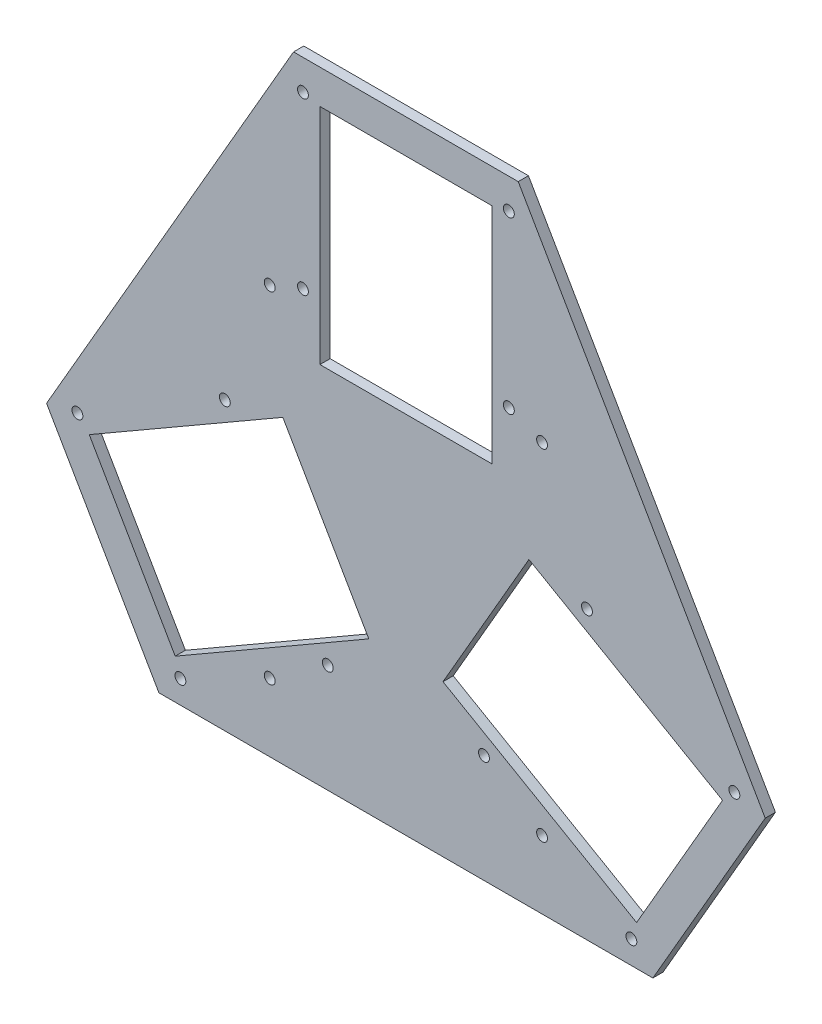
from build123d import *

# Parameters (mm, degrees)
SKETCH_1_R      = 1.6
SKETCH_1_W      = 50.5
SKETCH_1_H      = 65.673229248
EXTRUDE_1_DEPTH = 3


with BuildPart() as part:
    # ｽｹｯﾁ1 → ﾎﾞｽ - 押し出し1 (new body)
    with BuildSketch(Plane.XY):
        Polygon((33.003295935, 102.836614624), (-33.003295935, 102.836614624), (-105.560768671, -22.836614624), (-72.557472736, -80), (72.557472736, -80), (105.560768671, -22.836614624), align=None)
        with Locations((-66.245679964, -73.176652446)):
            Circle(SKETCH_1_R, mode=Mode.SUBTRACT)
        with Locations((-40, -60)):
            Circle(SKETCH_1_R, mode=Mode.SUBTRACT)
        with Locations((-22.944409775, -48.176652446)):
            Circle(SKETCH_1_R, mode=Mode.SUBTRACT)
        with Locations((-96.495679964, -20.782115517)):
            Circle(SKETCH_1_R, mode=Mode.SUBTRACT)
        with Locations((-53.194409775, 4.217884483)):
            Circle(SKETCH_1_R, mode=Mode.SUBTRACT)
        Polygon((-10.899181789, -35.448834134), (-67.773866666, -68.285448757), (-93.023866666, -24.551165866), (-36.149181789, 8.285448757), align=None, mode=Mode.SUBTRACT)
        with Locations((40, -60)):
            Circle(SKETCH_1_R, mode=Mode.SUBTRACT)
        with Locations((22.944409775, -48.176652446)):
            Circle(SKETCH_1_R, mode=Mode.SUBTRACT)
        with Locations((66.245679964, -73.176652446)):
            Circle(SKETCH_1_R, mode=Mode.SUBTRACT)
        Polygon((36.149181789, 8.285448757), (93.023866666, -24.551165866), (67.773866666, -68.285448757), (10.899181789, -35.448834134), align=None, mode=Mode.SUBTRACT)
        with Locations((96.495679964, -20.782115517)):
            Circle(SKETCH_1_R, mode=Mode.SUBTRACT)
        with Locations((53.194409775, 4.217884483)):
            Circle(SKETCH_1_R, mode=Mode.SUBTRACT)
        with Locations((-40, 40)):
            Circle(SKETCH_1_R, mode=Mode.SUBTRACT)
        with Locations((-30.25, 43.958767963)):
            Circle(SKETCH_1_R, mode=Mode.SUBTRACT)
        with Locations((0, 60)):
            Rectangle(SKETCH_1_W, SKETCH_1_H, mode=Mode.SUBTRACT)
        with Locations((-30.25, 93.958767963)):
            Circle(SKETCH_1_R, mode=Mode.SUBTRACT)
        with Locations((30.25, 43.958767963)):
            Circle(SKETCH_1_R, mode=Mode.SUBTRACT)
        with Locations((40, 40)):
            Circle(SKETCH_1_R, mode=Mode.SUBTRACT)
        with Locations((30.25, 93.958767963)):
            Circle(SKETCH_1_R, mode=Mode.SUBTRACT)
    extrude(amount=EXTRUDE_1_DEPTH)


solid = part.part
